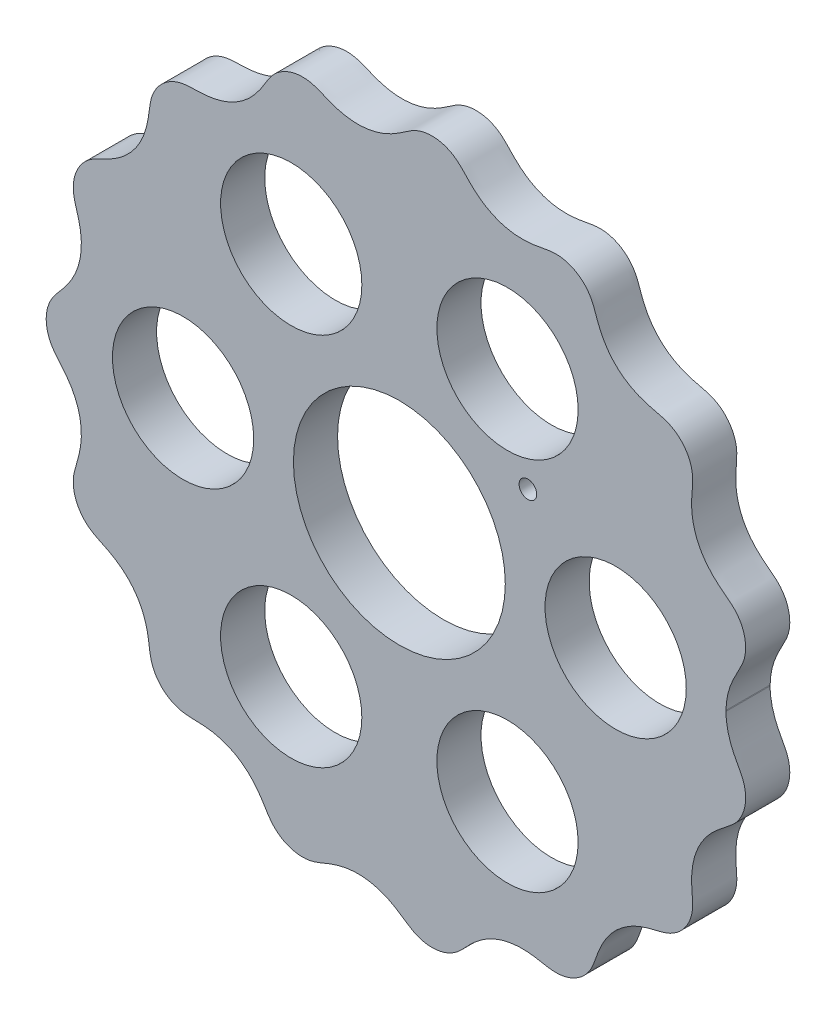
from build123d import *

# Parameters (mm, degrees)
BOSS_EXTRUDE1_DEPTH = 5
SKETCH2_R           = 12
SKETCH2_R_2         = 8
CUT_EXTRUDE1_DEPTH  = 57.653596622
SKETCH3_R           = 1
CUT_EXTRUDE2_DEPTH  = 57.653596622


# Read off the part's stored shape, not the designer's step: Boss-Extrude1
with BuildPart() as part:
    # Boss-Extrude1 outline → Boss-Extrude1 (new body)
    with BuildSketch(Plane.XY):
        with BuildLine():
            Line((36.998722033, -0.001054281), (36.99954865, 0.112257386))
            add(Edge.make_bspline(
                [(36.99954865, 0.112257386), (37.000270367, 0.161831196), (37.002853756, 0.261309148), (37.011083739, 0.475612896), (37.027751866, 0.686060064), (37.057401299, 0.973781963), (37.106377226, 1.31810626), (37.171822023, 1.656164832), (37.253267458, 1.993388321), (37.347124748, 2.325846439), (37.452941361, 2.655441957), (37.593357547, 3.033759794), (37.800770534, 3.51967602), (38.063070944, 4.054128866), (38.380004735, 4.635374121), (38.732518387, 5.273630146), (39.046751238, 6.008512211), (39.236640726, 6.858055977), (39.250091521, 7.787066394), (39.053564794, 8.75531068), (38.626208159, 9.732695543), (38.025700448, 10.517383756), (37.328054136, 11.091682662), (36.60811715, 11.629850376), (35.975000223, 12.138034306), (35.152550193, 12.91020298), (34.390673897, 13.870253643), (33.789981735, 14.95868362), (33.378085782, 16.145067451), (33.169373356, 17.154843178), (33.092097624, 18.112108135), (33.108904916, 19.000648259), (33.173614, 19.815733524), (33.238879281, 20.560019274), (33.227987247, 21.380129686), (33.047104395, 22.255228109), (32.664665017, 23.127768358), (32.06507968, 23.941852005), (31.23982104, 24.668864946), (30.167791626, 25.209669724), (29.000711136, 25.434830102), (27.857662069, 25.733478365), (26.84322374, 26.116856655), (25.973167428, 26.568653448), (25.160139265, 27.123784444), (24.422495656, 27.779104005), (23.770727885, 28.523846991), (23.215457794, 29.345954056), (22.792691619, 30.162245603), (22.47390955, 30.945683354), (22.219346682, 31.675325555), (21.987533976, 32.336511026), (21.659745235, 33.038802347), (21.169269169, 33.733285134), (20.490527161, 34.370384852), (19.62184838, 34.886918222), (18.721124416, 35.182924139), (17.841990931, 35.279542311), (17.032588114, 35.215325385), (16.30577961, 35.076867908), (15.510727511, 34.926325841), (14.638426571, 34.811573208), (13.688649268, 34.778978993), (12.671565392, 34.867723121), (11.447844853, 35.135462468), (10.292384973, 35.604508144), (9.244164008, 36.252478247), (8.244380121, 37.098840325), (7.447178549, 37.929698394), (6.674634431, 38.793502658), (5.68309281, 39.41558352), (4.66819347, 39.747034623), (3.692809843, 39.849081483), (2.630366398, 39.734817039), (1.530382972, 39.330180269), (0.594362483, 38.643900587), (-0.359798631, 37.997102241), (-1.301372389, 37.49269138), (-2.206771749, 37.131336425), (-3.161399566, 36.878076), (-4.150113917, 36.746090347), (-5.159112151, 36.741723073), (-6.170393876, 36.868024154), (-7.091417923, 37.098213056), (-7.919228397, 37.39230107), (-8.664576462, 37.704746935), (-9.345935181, 37.990582819), (-10.123662642, 38.220232855), (-11.002600535, 38.307242073), (-11.9445112, 38.204102119), (-12.901325323, 37.878615217), (-13.697734929, 37.395441616), (-14.321962314, 36.816489383), (-14.788333399, 36.196222631), (-15.15271525, 35.596738144), (-15.55423565, 34.935241327), (-16.030244773, 34.234700168), (-16.61524447, 33.523916779), (-17.33141745, 32.835420988), (-18.125443708, 32.24348686), (-18.984145093, 31.7575464), (-19.894861635, 31.385470152), (-20.838888358, 31.12642101), (-21.909595088, 30.963786363), (-23.088125921, 30.910663697), (-24.274994516, 30.932065517), (-25.434031129, 30.62446242), (-26.389157903, 30.085624441), (-27.141333946, 29.416783184), (-27.69727162, 28.643752428), (-28.058710579, 27.822059835), (-28.241105604, 27.01230335), (-28.332549336, 26.255181748), (-28.441352124, 25.435207729), (-28.613815275, 24.559922927), (-28.892199166, 23.643549075), (-29.306598206, 22.709052047), (-29.95580069, 21.642454051), (-30.768114001, 20.708833865), (-31.711629586, 19.931800273), (-32.675790022, 19.349849993), (-33.40030725, 18.98501049), (-34.214746578, 18.609763984), (-35.229470131, 18.07968265), (-36.114733026, 17.200706168), (-36.720075728, 16.030293846), (-36.984206131, 14.73501705), (-36.921436836, 13.540326839), (-36.536844923, 12.419312831), (-36.222064605, 11.285126273), (-36.044759387, 10.218808333), (-35.997118214, 9.243188269), (-36.067290528, 8.262910288), (-36.261191486, 7.295472475), (-36.577234742, 6.355849135), (-37.0088699, 5.458795345), (-37.599558744, 4.532516269), (-38.243938105, 3.735290386), (-38.885916528, 3.033020611), (-39.436551465, 2.254140701), (-39.796055658, 1.48046551), (-40.011497212, 0.573417452), (-40.026612923, -0.437283008), (-39.83543547, -1.364356277), (-39.483345482, -2.1726004), (-39.027053396, -2.841063846), (-38.546053167, -3.400176958), (-38.019306876, -4.011037517), (-37.4839594, -4.705445769), (-36.9799451, -5.507802007), (-36.546140169, -6.427806197), (-36.236329623, -7.387083398), (-36.053781782, -8.367659532), (-35.997037565, -9.354790726), (-36.059079888, -10.329485057), (-36.246239764, -11.38357784), (-36.566424081, -12.493071312), (-36.931379346, -13.597775621), (-36.980703376, -14.770029814), (-36.710370557, -16.057740558), (-36.09410814, -17.230756), (-35.067609609, -18.228819967), (-33.784970318, -18.798452451), (-32.751396611, -19.29632661), (-31.637911457, -19.983115099), (-30.501762392, -20.94144115), (-29.575814047, -22.135732199), (-28.925964108, -23.50281001), (-28.590028762, -24.66344732), (-28.428347132, -25.52966679), (-28.325131449, -26.334004858), (-28.232745376, -27.069385325), (-28.045129505, -27.860973503), (-27.682554734, -28.669502504), (-27.123409006, -29.436271159), (-26.364707126, -30.103880562), (-25.550537644, -30.553425904), (-24.740620095, -30.806480973), (-23.97308253, -30.902740914), (-23.273939358, -30.919490682), (-22.502855754, -30.935753534), (-21.660848761, -30.995699397), (-20.755458968, -31.143633919), (-19.803336359, -31.415038945), (-18.893624774, -31.802079177), (-18.041061706, -32.298846798), (-17.25961325, -32.899231861), (-16.557986937, -33.586951826), (-15.877270869, -34.433905919), (-15.237275543, -35.42990474), (-14.662795523, -36.472993139), (-13.817758148, -37.329214514), (-12.870992683, -37.89144908), (-11.91204679, -38.211565908), (-10.964987774, -38.307049033), (-10.078357726, -38.210724198), (-9.295914268, -37.96984607), (-8.609229525, -37.678839537), (-7.8557317, -37.365570415), (-7.017669629, -37.074469353), (-6.085831103, -36.850873928), (-5.062752273, -36.735276131), (-3.808276519, -36.757214235), (-2.585154279, -36.989126891), (-1.436131485, -37.415006627), (-0.296689553, -38.037508647), (0.643436405, -38.683822821), (1.575687506, -39.355623169), (2.669397264, -39.742606598), (3.723806861, -39.848834564), (4.694097873, -39.740195807), (5.715557522, -39.401367705), (6.720324277, -38.755118722), (7.656439553, -37.683960891), (8.83657926, -36.512961786), (10.161723139, -35.644794212), (11.538286303, -35.108041682), (12.750288343, -34.857416342), (13.745574669, -34.779578069), (14.670794337, -34.816123496), (15.514541118, -34.928897433), (16.279136012, -35.072817118), (16.971564564, -35.205288227), (17.748142508, -35.278608078), (18.600989485, -35.206427359), (19.496372698, -34.940981685), (20.380385726, -34.451026121), (21.088226956, -33.824538987), (21.612792464, -33.119704651), (21.96521667, -32.393866486), (22.209201019, -31.700415058), (22.47336021, -30.940939076), (22.80406093, -30.132196479), (23.243053928, -29.295611883), (23.817496134, -28.460842401), (24.649676677, -27.531606055), (25.809747588, -26.610264213), (27.225978407, -25.902033944), (28.82566442, -25.471890962), (30.216326183, -25.19491269), (31.272650701, -24.645093521), (32.073667779, -23.929645469), (32.650932336, -23.142109086), (33.084816806, -22.173026821), (33.292673149, -21.027507985), (33.173363035, -19.880870911), (33.085925414, -18.739242734), (33.120199423, -17.436854068), (33.33141262, -16.227060355), (33.747552539, -15.052890892), (34.360355928, -13.958928795), (34.973244187, -13.13577506), (35.6329212, -12.444924412), (36.303323804, -11.868151838), (36.949747372, -11.374502376), (37.542926334, -10.926101731), (38.138564068, -10.36834062), (38.661644623, -9.649469585), (39.051622501, -8.775534009), (39.253528668, -7.771627681), (39.232399083, -6.819885719), (39.03171435, -5.963997917), (38.706407116, -5.225345417), (38.348390806, -4.582262366), (38.030274513, -3.994030786), (37.768638219, -3.452599851), (37.563114133, -2.959998795), (37.424791209, -2.576230778), (37.321329499, -2.242346894), (37.245350457, -1.961010862), (37.19102617, -1.734632017), (37.143162747, -1.506409484), (37.101957025, -1.276429983), (37.067473649, -1.048557704), (37.039794321, -0.812504101), (37.021586593, -0.61210125), (37.010300225, -0.444046604), (37.002482905, -0.262758267), (36.999587895, -0.126805105), (36.998720424, -0.051157403), (36.998722033, -0.001054281)],
                knots=[0.069906552, 0.069906552, 0.069906552, 0.069906552, 0.069906552, 0.070662705, 0.071418858, 0.072175011, 0.072931163, 0.074443469, 0.075955774, 0.076711927, 0.07746808, 0.078980385, 0.08049269, 0.082004996, 0.084395977, 0.086786958, 0.08917794, 0.091568921, 0.094847068, 0.098125216, 0.101274746, 0.104424276, 0.108751929, 0.110915756, 0.113079582, 0.116233921, 0.119388259, 0.125696936, 0.129069551, 0.132442167, 0.135814782, 0.139187398, 0.141638114, 0.144088829, 0.146539545, 0.148990261, 0.152358337, 0.155726414, 0.158934823, 0.162143232, 0.166691212, 0.171239193, 0.174449338, 0.177659484, 0.18086963, 0.184079776, 0.187325474, 0.190571172, 0.19381687, 0.197062568, 0.199360109, 0.20165765, 0.203955191, 0.206252732, 0.209495427, 0.212738122, 0.216072123, 0.219406124, 0.221832132, 0.224258141, 0.226684149, 0.229110158, 0.23244866, 0.235787163, 0.239125665, 0.242464168, 0.248842239, 0.252031274, 0.25522031, 0.259595681, 0.263971051, 0.267155181, 0.270339311, 0.273527927, 0.276716543, 0.281098028, 0.285479514, 0.288672977, 0.291866441, 0.295059905, 0.298253368, 0.301587487, 0.304921605, 0.308255723, 0.311589842, 0.314012663, 0.316435485, 0.318858306, 0.321281127, 0.324610812, 0.327940497, 0.331187646, 0.334434795, 0.336735333, 0.339035871, 0.341336408, 0.343636946, 0.346887177, 0.350137408, 0.35338764, 0.356637871, 0.35984345, 0.363049029, 0.366254608, 0.369460188, 0.374002159, 0.37854413, 0.381748168, 0.384952206, 0.388295162, 0.391638118, 0.394139738, 0.396641357, 0.399142977, 0.401644597, 0.404988572, 0.408332548, 0.411676523, 0.415020498, 0.421320268, 0.424470152, 0.427620037, 0.42978082, 0.431941604, 0.436263171, 0.442553477, 0.44575116, 0.448948842, 0.4534821, 0.458015359, 0.461214295, 0.464413231, 0.467612167, 0.470811103, 0.474067915, 0.477324728, 0.48058154, 0.483838353, 0.488448153, 0.490753054, 0.493057954, 0.496311571, 0.499565188, 0.502888593, 0.506211997, 0.508630191, 0.511048385, 0.513466578, 0.515884772, 0.519212512, 0.522540252, 0.525867992, 0.529195732, 0.532395625, 0.535595519, 0.538795412, 0.541995305, 0.546385703, 0.5507761, 0.553971235, 0.55716637, 0.563521587, 0.567888097, 0.572254606, 0.575437202, 0.578619797, 0.584984988, 0.59167472, 0.595019587, 0.598364453, 0.600795097, 0.603225741, 0.605656385, 0.608087029, 0.611427296, 0.614767562, 0.618003803, 0.621240044, 0.623533226, 0.625826408, 0.628119589, 0.630412771, 0.633651874, 0.636890977, 0.640130079, 0.643369182, 0.646585958, 0.649802734, 0.65301951, 0.656236286, 0.66079302, 0.665349754, 0.668564511, 0.671779268, 0.67514097, 0.678502671, 0.680948815, 0.683394958, 0.685841102, 0.688287245, 0.691653534, 0.695019824, 0.698386113, 0.701752402, 0.708074014, 0.711234819, 0.714395625, 0.718732153, 0.723068681, 0.726224574, 0.729380466, 0.732567413, 0.73575436, 0.740272967, 0.744791574, 0.751166985, 0.757542395, 0.760810298, 0.764078201, 0.767346103, 0.770614006, 0.772926291, 0.775238576, 0.777550861, 0.779863146, 0.783127665, 0.786392183, 0.789704968, 0.793017752, 0.795428146, 0.79783854, 0.800248934, 0.802659328, 0.805976281, 0.809293235, 0.812610189, 0.815927142, 0.82228005, 0.828632958, 0.833136991, 0.837641023, 0.840817225, 0.843993427, 0.847160094, 0.850326761, 0.854678316, 0.859029872, 0.862201581, 0.86537329, 0.871716709, 0.875072299, 0.878427889, 0.881783479, 0.88513907, 0.887577489, 0.890015909, 0.892454329, 0.894892749, 0.898243686, 0.901594623, 0.904905775, 0.908216926, 0.910631245, 0.913045564, 0.915459883, 0.917874201, 0.919402492, 0.920930783, 0.922459074, 0.923223219, 0.923987364, 0.92475151, 0.925515655, 0.9262798, 0.927043946, 0.927808091, 0.928572236, 0.928954309, 0.929336382, 0.930100527, 0.930100527, 0.930100527, 0.930100527, 0.930100527], degree=4))
        make_face()
    extrude(amount=BOSS_EXTRUDE1_DEPTH)

    # Sketch2 → Cut-Extrude1 (cut, through all)
    with BuildSketch(Plane.XY.offset(5)):
        Circle(SKETCH2_R)
        with Locations((24.499360993, -0.001054281)):
            Circle(SKETCH2_R_2)
        with Locations((12.248767462, -21.217596137)):
            Circle(SKETCH2_R_2)
        with Locations((-12.250593531, -21.216541856)):
            Circle(SKETCH2_R_2)
        with Locations((-24.499360993, 0.001054281)):
            Circle(SKETCH2_R_2)
        with Locations((-12.248767462, 21.217596137)):
            Circle(SKETCH2_R_2)
        with Locations((12.250593531, 21.216541856)):
            Circle(SKETCH2_R_2)
    extrude(amount=-CUT_EXTRUDE1_DEPTH, mode=Mode.SUBTRACT)

    # Sketch3 → Cut-Extrude2 (cut, through all)
    with BuildSketch(Plane.XY.offset(5)):
        with Locations((14.562305899, 10.580134541)):
            Circle(SKETCH3_R)
    extrude(amount=-CUT_EXTRUDE2_DEPTH, mode=Mode.SUBTRACT)


solid = part.part
